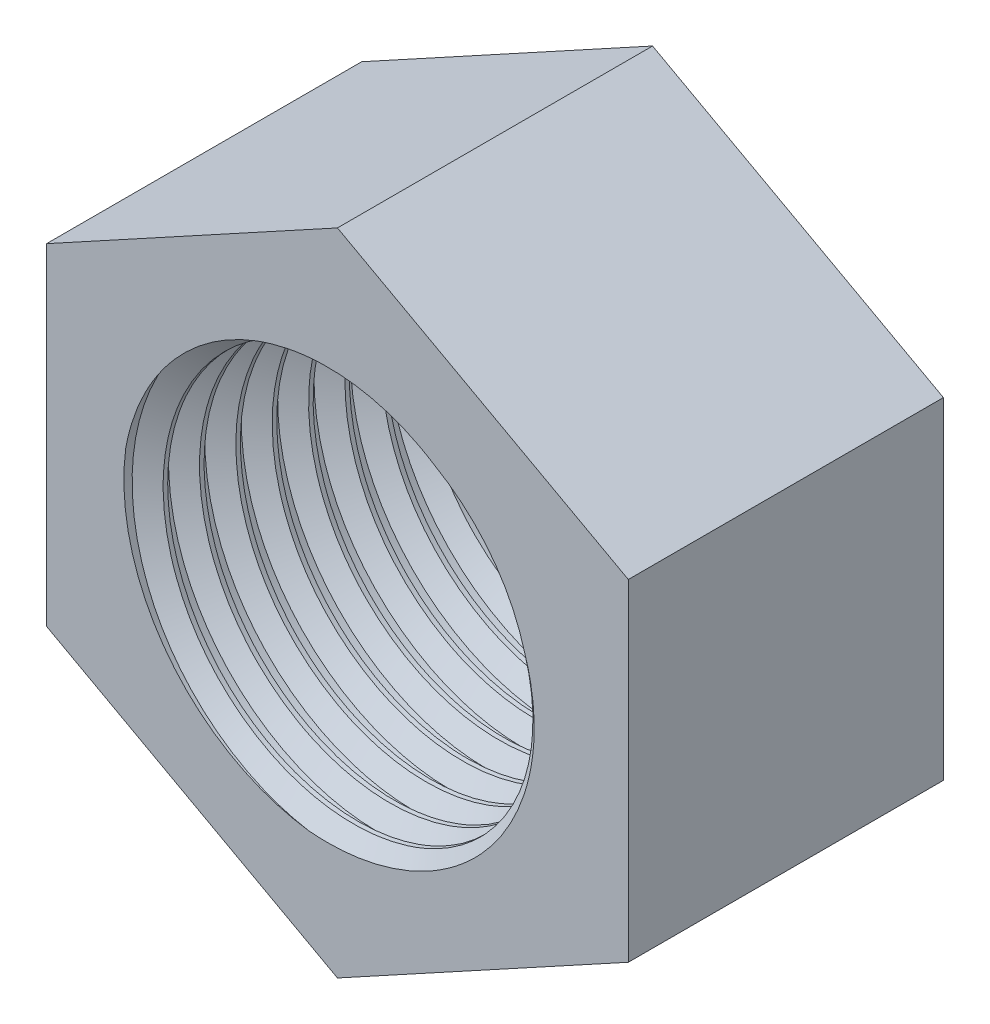
from build123d import *

# Parameters (mm, degrees)
SKETCH1_R           = 8
BOSS_EXTRUDE1_DEPTH = 13
THREAD1_PITCH       = 1.5


with BuildPart() as part:
    # Sketch1 → Boss-Extrude1 (new body)
    with BuildSketch(Plane.XY):
        Polygon((0, -13.4), (12, -6.838396113), (12, 6.838396113), (0, 13.4), (-12, 6.838396113), (-12, -6.838396113), align=None)
        with Locations(Location((0, 0, 0), (0, 0, 180))):
            Circle(SKETCH1_R, mode=Mode.SUBTRACT)
    extrude(amount=BOSS_EXTRUDE1_DEPTH)

    # Thread1: the profile of Thread Profile1 profile screwed along a right-hand helix of 18.666667 turns, 8 arcs to a turn; built about Z, then put on its axis
    thread1_z = Axis((0, 0, 0), (0, 0, 1))
    thread1_corners = [(7.9997, 0, -0.000173205), (7.9997, 0, 1.312673201), (8.811898813, 0, 0.843749998), (8.811898813, 0, 0.468749998)]
    with BuildLine(mode=Mode.PRIVATE) as thread1_profile:
        Line(thread1_corners[0], thread1_corners[1])
        Line(thread1_corners[1], thread1_corners[2])
        Line(thread1_corners[2], thread1_corners[3])
        Line(thread1_corners[3], thread1_corners[0])
    thread1_cap = Face(thread1_profile.wire())
    thread1_turn_angles = [0, 22.5, 45, 67.5, 90, 112.5, 135, 157.5, 180, 202.5, 225, 247.5, 270, 292.5, 315, 337.5, 360]
    thread1_turn_weights = [1, 0.9238795325112867, 1, 0.9238795325112867, 1, 0.9238795325112867, 1, 0.9238795325112867, 1, 0.9238795325112867, 1, 0.9238795325112867, 1, 0.9238795325112867, 1, 0.9238795325112867, 1]
    thread1_turn_rails = [Edge.make_bspline([Vector(p[0], p[1], 0).rotate(thread1_z, thread1_turn_angles[k]) / thread1_turn_weights[k] + Vector(0, 0, p[2] + THREAD1_PITCH * thread1_turn_angles[k] / 360) for k in range(17)], [0, 0, 0, 1, 1, 2, 2, 3, 3, 4, 4, 5, 5, 6, 6, 7, 7, 8, 8, 8], 2, thread1_turn_weights) for p in thread1_corners]
    thread1_turn_sides = [Face.make_surface_from_curves(thread1_turn_rails[p[0]], thread1_turn_rails[p[1]]) for p in [(0, 1), (1, 2), (2, 3), (3, 0)]]
    thread1_last_angles = [6480, 6502.5, 6525, 6547.5, 6570, 6592.5, 6615, 6637.5, 6660, 6682.5, 6705, 6712.5, 6720]
    thread1_last_weights = [1, 0.9238795325112867, 1, 0.9238795325112867, 1, 0.9238795325112867, 1, 0.9238795325112867, 1, 0.9238795325112867, 1, 0.9914448613738125, 1]
    thread1_last_rails = [Edge.make_bspline([Vector(p[0], p[1], 0).rotate(thread1_z, thread1_last_angles[k]) / thread1_last_weights[k] + Vector(0, 0, p[2] + THREAD1_PITCH * thread1_last_angles[k] / 360) for k in range(13)], [0, 0, 0, 1, 1, 2, 2, 3, 3, 4, 4, 5, 5, 6, 6, 6], 2, thread1_last_weights) for p in thread1_corners]
    thread1_last_sides = [Face.make_surface_from_curves(thread1_last_rails[p[0]], thread1_last_rails[p[1]]) for p in [(0, 1), (1, 2), (2, 3), (3, 0)]]
    thread1 = Plane(origin=(0, 0, 18), x_dir=(-1, 0, 0), z_dir=(0, 0, -1)) * Solid(Shell([*[p.moved(Location((0, 0, THREAD1_PITCH * i))) for i in range(18) for p in thread1_turn_sides], *thread1_last_sides, thread1_cap, thread1_cap.rotate(thread1_z, 6720).moved(Location((0, 0, THREAD1_PITCH * 6720 / 360)))]))
    add(thread1, mode=Mode.SUBTRACT)


solid = part.part
